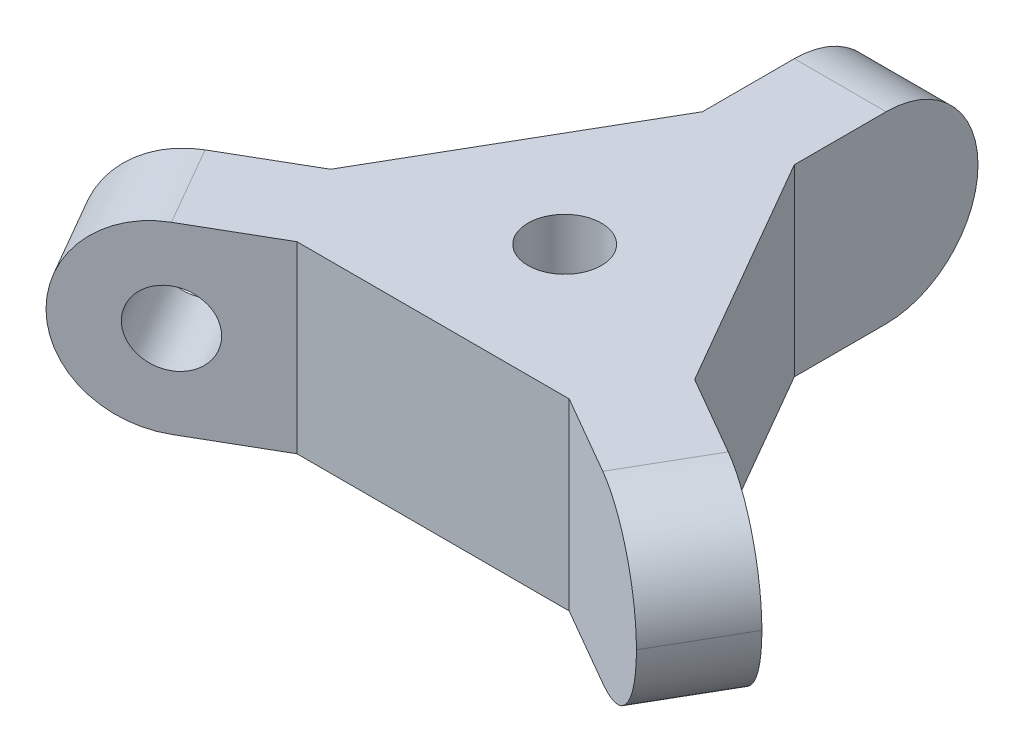
from build123d import *

# Parameters (mm, degrees)
SKETCH1_R           = 1.27
SKETCH1_W           = 3.175
SKETCH1_H           = 6.35
BOSS_EXTRUDE1_DEPTH = 6.35
CUT_EXTRUDE1_REACH  = 21.921
SKETCH2_R           = 1.27
FILLET1_R           = 3.175


with BuildPart() as part:
    # Sketch1 → Boss-Extrude1 (new body)
    # profile 1 of 4: a face of its own
    with BuildSketch(Plane(origin=(0, 0, 0), x_dir=(1, 0, 0), z_dir=(0, 1, 0))):
        Polygon((4.705511314, -4.549815329), (6.293011314, -1.800184671), (1.5875, 6.35), (-1.5875, 6.35), (-6.293011314, -1.800184671), (-4.705511314, -4.549815329), align=None)
        with Locations(Location((0, 0, 0), (0, 0, 270))):
            Circle(SKETCH1_R, mode=Mode.SUBTRACT)
    # profile 2 of 4: a face of its own
    with BuildSketch(Plane(origin=(0, 0, 0), x_dir=(1, 0, 0), z_dir=(0, 1, 0))):
        Polygon((-11.792272628, -4.975184671), (-10.204772628, -7.724815329), (-4.705511314, -4.549815329), (-6.293011314, -1.800184671), align=None)
    # profile 3 of 4: a face of its own
    with BuildSketch(Plane(origin=(0, 0, 0), x_dir=(1, 0, 0), z_dir=(0, 1, 0))):
        Polygon((10.204772628, -7.724815329), (11.792272628, -4.975184671), (6.293011314, -1.800184671), (4.705511314, -4.549815329), align=None)
    # profile 4 of 4: a face of its own
    with BuildSketch(Plane(origin=(0, 0, 0), x_dir=(1, 0, 0), z_dir=(0, 1, 0))):
        with Locations((0, 9.525)):
            Rectangle(SKETCH1_W, SKETCH1_H)
    extrude(amount=BOSS_EXTRUDE1_DEPTH)

    # Sketch2 → Cut-Extrude1 (cut, up to next)
    with BuildSketch(Plane(origin=(0.79375, 0, 1.374815329), x_dir=(0.8660254037844384, 0, -0.5000000000000006), z_dir=(0.5000000000000006, 0, 0.8660254037844384)), mode=Mode.PRIVATE) as cut_extrude1_sk1:
        with Locations((-9.525, 3.175)):
            Circle(SKETCH2_R)
    cut_extrude1_tool1 = extrude(cut_extrude1_sk1.sketch, amount=-CUT_EXTRUDE1_REACH, mode=Mode.PRIVATE) & part.part
    add(cut_extrude1_tool1.solids().sort_by_distance((-7.455142, 3.175, 6.137315))[0], mode=Mode.SUBTRACT)

    # Fillet1
    fillet1_edges = [part.edges().sort_by_distance(p)[0] for p in [
        (0, 0, -12.7),
        (0, 6.35, -12.7),
        (10.998522628, 0, 6.35),
        (10.998522628, 6.35, 6.35),
        (-10.998522628, 0, 6.35),
        (-10.998522628, 6.35, 6.35),
    ]]
    fillet(fillet1_edges, radius=FILLET1_R - 0.0001)  # a hair under: the kernel refuses the full size


solid = part.part
